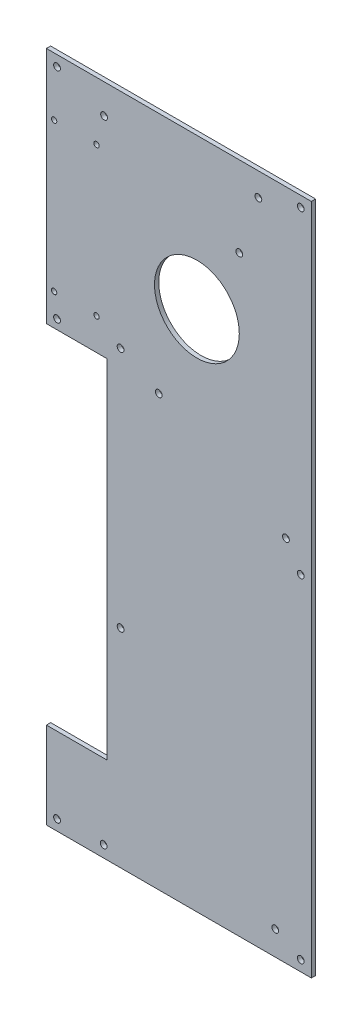
from build123d import *

# Parameters (mm, degrees)
SKETCH1_R           = 1.6
SKETCH1_R_2         = 20
SKETCH1_R_3         = 1.25
BOSS_EXTRUDE1_DEPTH = 2


with BuildPart() as part:
    # Sketch1 → Boss-Extrude1 (new body)
    with BuildSketch(Plane(origin=(0, 0, 0), x_dir=(0, 1, 0), z_dir=(0, 0, 1))):
        Polygon((-98, 35), (-98, -90), (219.3, -90), (219.3, 35), (106.85, 35), (106.85, 6.35), (-57.15, 6.35), (-57.15, 35), align=None)
        with Locations((-92.5, 8)):
            Circle(SKETCH1_R, mode=Mode.SUBTRACT)
        with Locations((-93, 30)):
            Circle(SKETCH1_R, mode=Mode.SUBTRACT)
        with Locations((205.3, 7.8)):
            Circle(SKETCH1_R, mode=Mode.SUBTRACT)
        with Locations((114.3, 0)):
            Circle(SKETCH1_R, mode=Mode.SUBTRACT)
        with Locations((-93, -85)):
            Circle(SKETCH1_R, mode=Mode.SUBTRACT)
        with Locations((-86.5, -73)):
            Circle(SKETCH1_R, mode=Mode.SUBTRACT)
        with Locations((64.3, -85)):
            Circle(SKETCH1_R, mode=Mode.SUBTRACT)
        with Locations((75.7, -78)):
            Circle(SKETCH1_R, mode=Mode.SUBTRACT)
        with Locations((214.3, -85)):
            Circle(SKETCH1_R, mode=Mode.SUBTRACT)
        with Locations((208.3, -65)):
            Circle(SKETCH1_R, mode=Mode.SUBTRACT)
        with Locations((181.3, -56)):
            Circle(SKETCH1_R, mode=Mode.SUBTRACT)
        with Locations((148.3, -36)):
            Circle(SKETCH1_R_2, mode=Mode.SUBTRACT)
        Circle(SKETCH1_R, mode=Mode.SUBTRACT)
        with Locations((104.8, -18)):
            Circle(SKETCH1_R, mode=Mode.SUBTRACT)
        with Locations((191.85, 31.35)):
            Circle(SKETCH1_R_3, mode=Mode.SUBTRACT)
        with Locations((121.85, 11.35)):
            Circle(SKETCH1_R_3, mode=Mode.SUBTRACT)
        with Locations((111.3, 30)):
            Circle(SKETCH1_R, mode=Mode.SUBTRACT)
        with Locations((121.85, 31.35)):
            Circle(SKETCH1_R_3, mode=Mode.SUBTRACT)
        with Locations((191.85, 11.35)):
            Circle(SKETCH1_R_3, mode=Mode.SUBTRACT)
        with Locations((214.3, 30)):
            Circle(SKETCH1_R, mode=Mode.SUBTRACT)
    extrude(amount=-BOSS_EXTRUDE1_DEPTH)


solid = part.part
